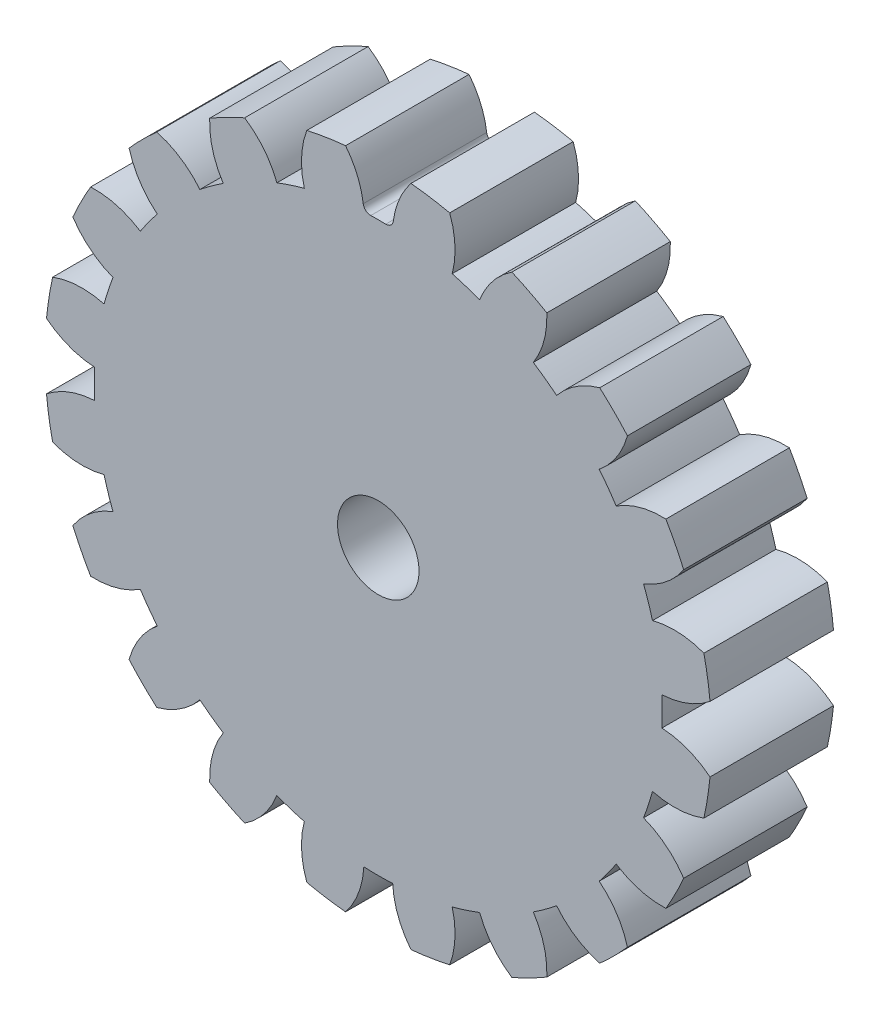
from build123d import *

# Parameters (mm, degrees)
SKETCH1_R                      = 13.5
BOSS_EXTRUDE1_DEPTH            = 2.5
CUT_EXTRUDE1_DEPTH             = 20.254869514
FILLET2_R                      = 0.3
CIRPATTERN1_COUNT              = 20
THROUGH_CENTER_HOLE_DEPTH      = 20.16365562
THROUGH_CENTER_HOLE_DEPTH_BACK = 20.16365562
SKETCH4_R                      = 1.65


with BuildPart() as part:
    # Sketch1 → Boss-Extrude1 (new, symmetric)
    with BuildSketch(Plane.XY):
        Circle(SKETCH1_R)
    extrude(amount=BOSS_EXTRUDE1_DEPTH, both=True)

    # Sketch3 → Cut-Extrude1 (cut, symmetric)
    with BuildSketch(Plane.XY):
        with BuildLine():
            ThreePointArc((-2.366823072, 14.305528601), (-1.105791606, 13.129025021), (-0.584218442, 11.485150796))
            ThreePointArc((-0.584218442, 11.485150796), (0, 11.5), (0.584218442, 11.485150796))
            ThreePointArc((0.584218442, 11.485150796), (1.105791606, 13.129025021), (2.366823072, 14.305528601))
            ThreePointArc((2.366823072, 14.305528601), (0, 14.5), (-2.366823072, 14.305528601))
        make_face()
    cut_extrude1 = extrude(amount=CUT_EXTRUDE1_DEPTH, both=True, mode=Mode.SUBTRACT)

    # Fillet2
    fillet2_edges = [part.edges().sort_by_distance(p)[0] for p in [
        (0.584218442, 11.485150796, 0),
        (-0.584218442, 11.485150796, 0),
    ]]
    fillet(fillet2_edges, radius=FILLET2_R)

    # CirPattern1: Cut-Extrude1 ×20 about axis
    cirpattern1_axis = Axis((0, 0, 2.5), (0, 0, -1))
    for i in range(1, CIRPATTERN1_COUNT):
        add(cut_extrude1.rotate(cirpattern1_axis, i * 360 / CIRPATTERN1_COUNT), mode=Mode.SUBTRACT)

    # Sketch4 → Through_Center_Hole (cut, two sides: drawn at the far end of the back side and taken through both)
    with BuildSketch(Plane.XY.offset(-THROUGH_CENTER_HOLE_DEPTH_BACK)):
        Circle(SKETCH4_R)
    extrude(amount=THROUGH_CENTER_HOLE_DEPTH + THROUGH_CENTER_HOLE_DEPTH_BACK, mode=Mode.SUBTRACT)


solid = part.part
